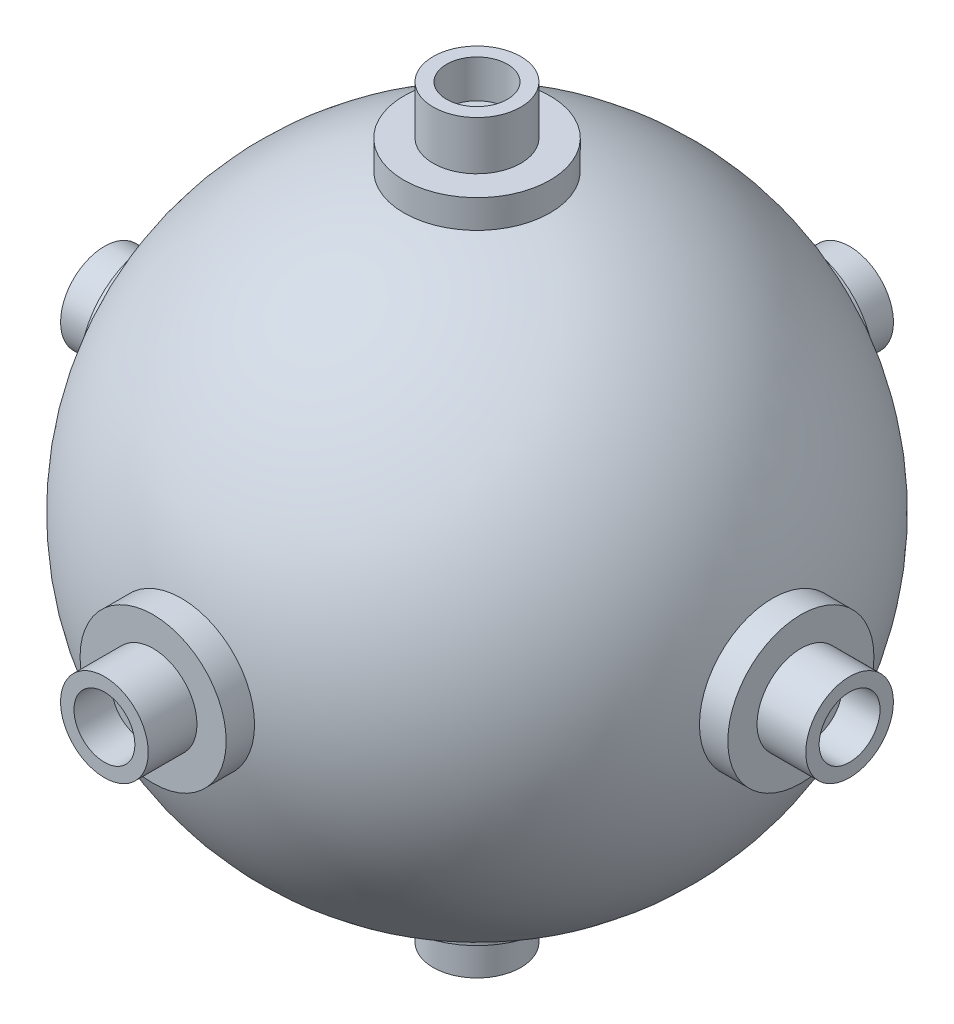
from build123d import *

# Parameters (mm, degrees)
SKETCH6_R           = 3.81
BOSS_EXTRUDE1_DEPTH = 1.016
SKETCH9_R           = 2.286
BOSS_EXTRUDE3_DEPTH = 2.54
CIRPATTERN1_COUNT   = 4
SKETCH10_R          = 3.81
BOSS_EXTRUDE4_DEPTH = 1.016
SKETCH11_R          = 2.286
BOSS_EXTRUDE5_DEPTH = 2.54
CIRPATTERN2_COUNT   = 4


with BuildPart() as part:
    # Sketch1 → Revolve1 (revolve)
    with BuildSketch(Plane.XY):
        with BuildLine():
            Line((0, -15.875), (0, 15.875))
            ThreePointArc((0, 15.875), (-15.875, 0), (0, -15.875))
        make_face()
    revolve(axis=Axis((0, 15.875, 0), (0, -1, 0)))

    # Sketch6 → Boss-Extrude1 (add, symmetric)
    with BuildSketch(Plane.XY.offset(15.875)):
        Circle(SKETCH6_R)
    boss_extrude1 = extrude(amount=BOSS_EXTRUDE1_DEPTH, both=True)

    # Sketch9 → Boss-Extrude3 (add)
    with BuildSketch(Plane.XY.offset(16.891)):
        Circle(SKETCH9_R)
    boss_extrude3 = extrude(amount=BOSS_EXTRUDE3_DEPTH)

    # CirPattern1: Boss-Extrude1, Boss-Extrude3 ×4 about axis
    cirpattern1_axis = Axis((0, 15.875, 0), (0, -1, 0))
    add([boss_extrude1.rotate(cirpattern1_axis, i * 360 / CIRPATTERN1_COUNT) for i in range(1, CIRPATTERN1_COUNT)])
    add([boss_extrude3.rotate(cirpattern1_axis, i * 360 / CIRPATTERN1_COUNT) for i in range(1, CIRPATTERN1_COUNT)])

    # Sketch10 → Boss-Extrude4 (add, symmetric)
    with BuildSketch(Plane(origin=(0, 15.875, 0), x_dir=(1, 0, 0), z_dir=(0, 1, 0))):
        Circle(SKETCH10_R)
    boss_extrude4 = extrude(amount=BOSS_EXTRUDE4_DEPTH, both=True)

    # Sketch11 → Boss-Extrude5 (add)
    with BuildSketch(Plane(origin=(0, 16.891, 0), x_dir=(1, 0, 0), z_dir=(0, 1, 0))):
        Circle(SKETCH11_R)
    boss_extrude5 = extrude(amount=BOSS_EXTRUDE5_DEPTH)

    # Mirror1: Boss-Extrude4, Boss-Extrude5 across plane
    add(boss_extrude4.mirror(Plane.ZX))
    add(boss_extrude5.mirror(Plane.ZX))

    # Sketch13 → CBORE for _00 Binding Head Machine Screw (revolve, cut)
    with BuildSketch(Plane(origin=(0, 19.431, 0), x_dir=(0, 0, 1), z_dir=(1, 0, 0))):
        Polygon((0, 0), (0, 4.229701142), (0.6985, 3.81), (0.6985, 1.9812), (1.5875, 1.9812), (1.5875, 0), align=None)
    cbore_for_00_binding_head_machine_screw = revolve(axis=Axis((0, 25.781, 0), (0, -1, 0)), mode=Mode.SUBTRACT)

    # CirPattern2: CBORE for _00 Binding Head Machine Screw ×4 about axis
    cirpattern2_axis = Axis((-15.875, 0, 0), (1, 0, 0))
    for i in range(1, CIRPATTERN2_COUNT):
        add(cbore_for_00_binding_head_machine_screw.rotate(cirpattern2_axis, i * 360 / CIRPATTERN2_COUNT), mode=Mode.SUBTRACT)

    # Sketch19 → CBORE for _00 Binding Head Machine S 2 (revolve, cut)
    with BuildSketch(Plane(origin=(19.431, 0, 0), x_dir=(0, 0, -1), z_dir=(0, 1, 0))):
        Polygon((0, 0), (0, 4.229701142), (0.6985, 3.81), (0.6985, 1.9812), (1.5875, 1.9812), (1.5875, 0), align=None)
    cbore_for_00_binding_head_machine_s_2 = revolve(axis=Axis((25.781, 0, 0), (-1, 0, 0)), mode=Mode.SUBTRACT)

    # Mirror2: CBORE for _00 Binding Head Machine S 2 across plane
    add(cbore_for_00_binding_head_machine_s_2.mirror(Plane(origin=(0, 0, 0), x_dir=(0, 0, 1), z_dir=(1, 0, 0))), mode=Mode.SUBTRACT)


solid = part.part
